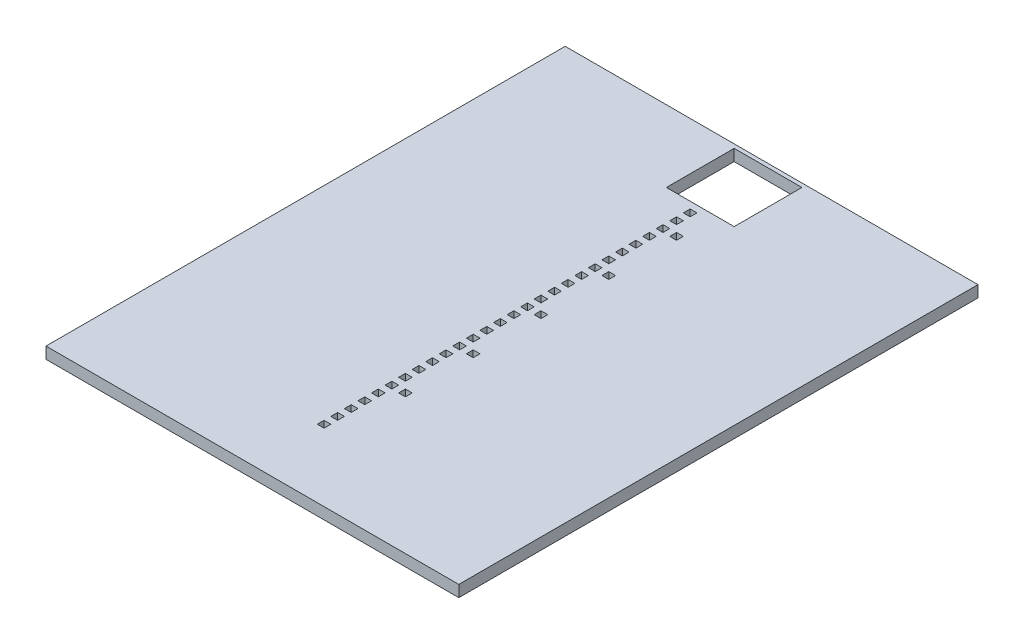
from build123d import *

# Parameters (mm, degrees)
SKETCH1_W           = 609
SKETCH1_H           = 766
SKETCH1_W_2         = 10
SKETCH1_H_2         = 10
SKETCH1_W_3         = 100
SKETCH1_H_3         = 100
BOSS_EXTRUDE1_DEPTH = 17


with BuildPart() as part:
    # Sketch1 → Boss-Extrude1 (new body)
    with BuildSketch(Plane(origin=(0, 0, 0), x_dir=(1, 0, 0), z_dir=(0, 1, 0))):
        with Locations((-0.5, -327.27)):
            Rectangle(SKETCH1_W, SKETCH1_H)
        with Locations((0, -85)):
            Rectangle(SKETCH1_W_2, SKETCH1_H_2, mode=Mode.SUBTRACT)
        Rectangle(SKETCH1_W_3, SKETCH1_H_3, mode=Mode.SUBTRACT)
        with Locations((0, -65)):
            Rectangle(SKETCH1_W_2, SKETCH1_H_2, mode=Mode.SUBTRACT)
        with Locations((0, -105)):
            Rectangle(SKETCH1_W_2, SKETCH1_H_2, mode=Mode.SUBTRACT)
        with Locations((0, -125)):
            Rectangle(SKETCH1_W_2, SKETCH1_H_2, mode=Mode.SUBTRACT)
        with Locations((0, -145)):
            Rectangle(SKETCH1_W_2, SKETCH1_H_2, mode=Mode.SUBTRACT)
        with Locations((0, -165)):
            Rectangle(SKETCH1_W_2, SKETCH1_H_2, mode=Mode.SUBTRACT)
        with Locations((0, -185)):
            Rectangle(SKETCH1_W_2, SKETCH1_H_2, mode=Mode.SUBTRACT)
        with Locations((0, -205)):
            Rectangle(SKETCH1_W_2, SKETCH1_H_2, mode=Mode.SUBTRACT)
        with Locations((0, -225)):
            Rectangle(SKETCH1_W_2, SKETCH1_H_2, mode=Mode.SUBTRACT)
        with Locations((0, -245)):
            Rectangle(SKETCH1_W_2, SKETCH1_H_2, mode=Mode.SUBTRACT)
        with Locations((0, -265)):
            Rectangle(SKETCH1_W_2, SKETCH1_H_2, mode=Mode.SUBTRACT)
        with Locations((0, -285)):
            Rectangle(SKETCH1_W_2, SKETCH1_H_2, mode=Mode.SUBTRACT)
        with Locations((0, -305)):
            Rectangle(SKETCH1_W_2, SKETCH1_H_2, mode=Mode.SUBTRACT)
        with Locations((0, -325)):
            Rectangle(SKETCH1_W_2, SKETCH1_H_2, mode=Mode.SUBTRACT)
        with Locations((0, -345)):
            Rectangle(SKETCH1_W_2, SKETCH1_H_2, mode=Mode.SUBTRACT)
        with Locations((0, -365)):
            Rectangle(SKETCH1_W_2, SKETCH1_H_2, mode=Mode.SUBTRACT)
        with Locations((0, -385)):
            Rectangle(SKETCH1_W_2, SKETCH1_H_2, mode=Mode.SUBTRACT)
        with Locations((0, -405)):
            Rectangle(SKETCH1_W_2, SKETCH1_H_2, mode=Mode.SUBTRACT)
        with Locations((0, -425)):
            Rectangle(SKETCH1_W_2, SKETCH1_H_2, mode=Mode.SUBTRACT)
        with Locations((0, -445)):
            Rectangle(SKETCH1_W_2, SKETCH1_H_2, mode=Mode.SUBTRACT)
        with Locations((0, -465)):
            Rectangle(SKETCH1_W_2, SKETCH1_H_2, mode=Mode.SUBTRACT)
        with Locations((0, -485)):
            Rectangle(SKETCH1_W_2, SKETCH1_H_2, mode=Mode.SUBTRACT)
        with Locations((0, -505)):
            Rectangle(SKETCH1_W_2, SKETCH1_H_2, mode=Mode.SUBTRACT)
        with Locations((0, -525)):
            Rectangle(SKETCH1_W_2, SKETCH1_H_2, mode=Mode.SUBTRACT)
        with Locations((0, -545)):
            Rectangle(SKETCH1_W_2, SKETCH1_H_2, mode=Mode.SUBTRACT)
        with Locations((0, -565)):
            Rectangle(SKETCH1_W_2, SKETCH1_H_2, mode=Mode.SUBTRACT)
        with Locations((0, -585)):
            Rectangle(SKETCH1_W_2, SKETCH1_H_2, mode=Mode.SUBTRACT)
        with Locations((0, -605)):
            Rectangle(SKETCH1_W_2, SKETCH1_H_2, mode=Mode.SUBTRACT)
        with Locations((20, -105)):
            Rectangle(SKETCH1_W_2, SKETCH1_H_2, mode=Mode.SUBTRACT)
        with Locations((20, -205)):
            Rectangle(SKETCH1_W_2, SKETCH1_H_2, mode=Mode.SUBTRACT)
        with Locations((20, -305)):
            Rectangle(SKETCH1_W_2, SKETCH1_H_2, mode=Mode.SUBTRACT)
        with Locations((20, -405)):
            Rectangle(SKETCH1_W_2, SKETCH1_H_2, mode=Mode.SUBTRACT)
        with Locations((20, -505)):
            Rectangle(SKETCH1_W_2, SKETCH1_H_2, mode=Mode.SUBTRACT)
    extrude(amount=BOSS_EXTRUDE1_DEPTH)


solid = part.part
